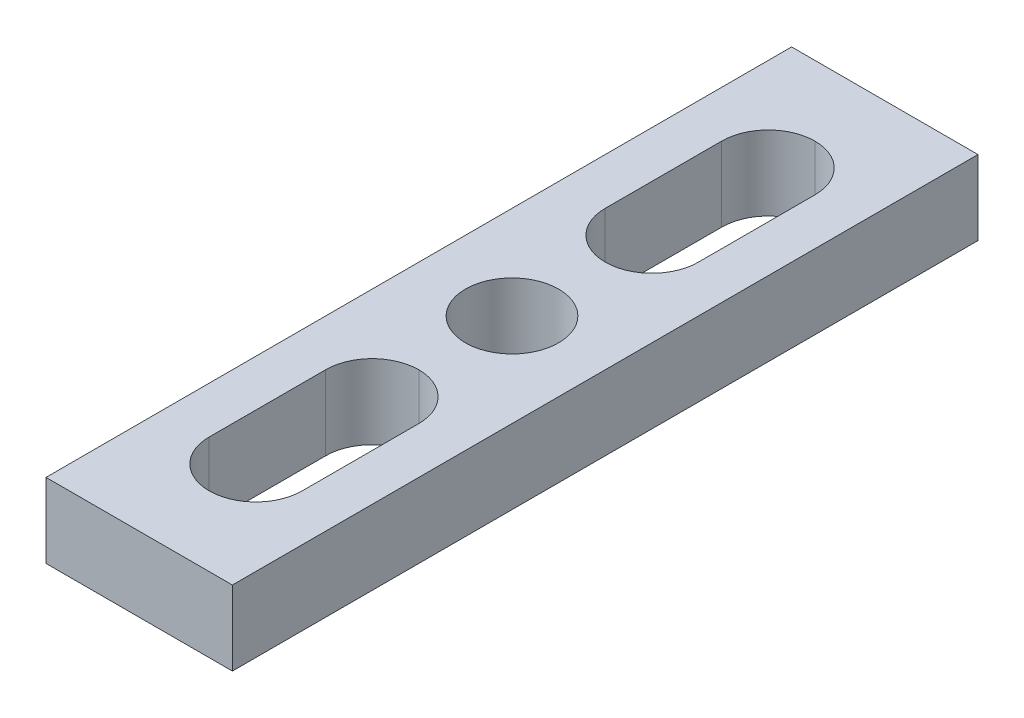
from build123d import *

# Parameters (mm, degrees)
SKETCH1_W           = 25.4
SKETCH1_H           = 10.16
BOSS_EXTRUDE1_DEPTH = 101.6
SKETCH2_R           = 6.35
CUT_EXTRUDE1_DEPTH  = 88.9
SKETCH5_W           = 12.7
SKETCH5_H           = 28.575
CUT_EXTRUDE3_DEPTH  = 15.875
FILLET1_R           = 6.35


with BuildPart() as part:
    # Sketch1 → Boss-Extrude1 (new body)
    with BuildSketch(Plane.XY):
        with Locations((0, 5.08)):
            Rectangle(SKETCH1_W, SKETCH1_H)
    extrude(amount=BOSS_EXTRUDE1_DEPTH)

    # Sketch2 → Cut-Extrude1 (cut)
    with BuildSketch(Plane(origin=(0, 10.16, 0), x_dir=(1, 0, 0), z_dir=(0, 1, 0))):
        with Locations(Location((0, -50.8, 0), (0, 0, 180))):
            Circle(SKETCH2_R)
    extrude(amount=-CUT_EXTRUDE1_DEPTH, mode=Mode.SUBTRACT)

    # Sketch5 → Cut-Extrude3 (cut)
    with BuildSketch(Plane(origin=(0, 10.16, 0), x_dir=(1, 0, 0), z_dir=(0, 1, 0))):
        with Locations((0, -77.7875)):
            Rectangle(SKETCH5_W, SKETCH5_H)
        with Locations((0, -23.8125)):
            Rectangle(SKETCH5_W, SKETCH5_H)
    extrude(amount=-CUT_EXTRUDE3_DEPTH, mode=Mode.SUBTRACT)

    # Fillet1
    fillet1_edges = [part.edges().sort_by_distance(p)[0] for p in [
        (-6.35, 5.08, 92.075),
        (-6.35, 5.08, 38.1),
        (-6.35, 5.08, 63.5),
        (-6.35, 5.08, 9.525),
        (6.35, 5.08, 9.525),
        (6.35, 5.08, 63.5),
        (6.35, 5.08, 92.075),
        (6.35, 5.08, 38.1),
    ]]
    fillet(fillet1_edges, radius=FILLET1_R - 0.0001)  # a hair under: the kernel refuses the full size


solid = part.part
